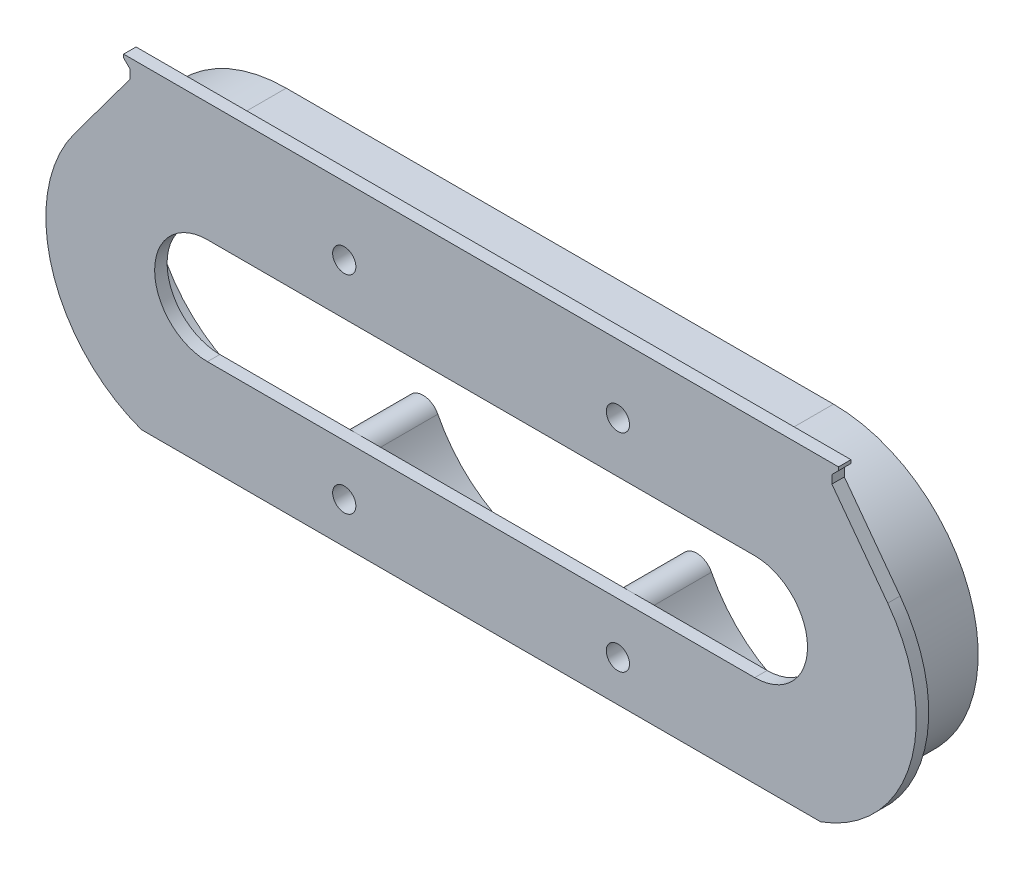
from build123d import *

# Parameters (mm, degrees)
SKETCH1_R               = 1.2
BOSS_EXTRUDE1_DEPTH     = 8
BOSS_EXTRUDE2_DEPTH     = 1.5
CUT_EXTRUDE1_DEPTH      = 125.252015178
CUT_EXTRUDE1_DEPTH_BACK = 125.252015178
SKETCH3_R               = 1.4
CUT_EXTRUDE2_DEPTH      = 125.252015178
SKETCH5_W               = 117.271867341
SKETCH5_H               = 6.016252737
CUT_EXTRUDE3_DEPTH      = 125.252015178


with BuildPart() as part:
    # Sketch1 → Boss-Extrude1 (new body)
    with BuildSketch(Plane.XY):
        with BuildLine():
            Line((32.794822831, -0.95), (98.794822831, -0.95))
            ThreePointArc((98.794822831, -0.95), (116.244822831, 16.5), (98.794822831, 33.95))
            Line((98.794822831, 33.95), (32.794822831, 33.95))
            ThreePointArc((32.794822831, 33.95), (15.344822831, 16.5), (32.794822831, -0.95))
        make_face()
        with Locations((82.294822831, 29)):
            Circle(SKETCH1_R, mode=Mode.SUBTRACT)
        with Locations((49.294822831, 4)):
            Circle(SKETCH1_R, mode=Mode.SUBTRACT)
        with Locations((82.294822831, 4)):
            Circle(SKETCH1_R, mode=Mode.SUBTRACT)
        with Locations((49.294822831, 29)):
            Circle(SKETCH1_R, mode=Mode.SUBTRACT)
        with BuildLine():
            ThreePointArc((84.078606615, 9.037897061), (82.294822831, 10.133399735), (80.511039047, 9.037897061))
            ThreePointArc((80.511039047, 9.037897061), (65.794822831, 0), (51.078606615, 9.037897061))
            ThreePointArc((51.078606615, 9.037897061), (49.294822831, 10.133399735), (47.511039047, 9.037897061))
            ThreePointArc((47.511039047, 9.037897061), (16.294822831, 16.5), (47.511039047, 23.962102939))
            ThreePointArc((47.511039047, 23.962102939), (49.294822831, 22.866600265), (51.078606615, 23.962102939))
            ThreePointArc((51.078606615, 23.962102939), (65.794822831, 33), (80.511039047, 23.962102939))
            ThreePointArc((80.511039047, 23.962102939), (82.294822831, 22.866600265), (84.078606615, 23.962102939))
            ThreePointArc((84.078606615, 23.962102939), (115.294822831, 16.5), (84.078606615, 9.037897061))
        make_face(mode=Mode.SUBTRACT)
    extrude(amount=BOSS_EXTRUDE1_DEPTH)

    # Sketch2 → Boss-Extrude2 (add)
    with BuildSketch(Plane.XY.offset(8)):
        with BuildLine():
            Line((30.807257811, -2), (100.782387851, -2))
            ThreePointArc((100.782387851, -2), (116.415253744, 7.634664408), (114.834700595, 25.929885261))
            Line((114.834700595, 25.929885261), (108.102694429, 35))
            Line((108.102694429, 35), (108.102694429, 36))
            Line((108.102694429, 36), (108.902694429, 36.8))
            Line((108.902694429, 36.8), (108.902694429, 37.2))
            Line((108.902694429, 37.2), (22.686951233, 37.2))
            Line((22.686951233, 37.2), (22.686951233, 36.8))
            Line((22.686951233, 36.8), (23.486951233, 36))
            Line((23.486951233, 36), (23.486951233, 35))
            Line((23.486951233, 35), (16.754945067, 25.929885261))
            ThreePointArc((16.754945067, 25.929885261), (15.174391918, 7.634664408), (30.807257811, -2))
        make_face()
    extrude(amount=BOSS_EXTRUDE2_DEPTH)

    # Sketch3 → Cut-Extrude1 (cut, two sides: drawn at the far end of the back side and taken through both)
    with BuildSketch(Plane(origin=(0, 0, 8), x_dir=(-1, 0, 0), z_dir=(0, 0, -1)).offset(-CUT_EXTRUDE1_DEPTH_BACK)):
        with Locations((-49.294822831, 29)):
            Circle(SKETCH3_R)
        with Locations((-49.294822831, 4)):
            Circle(SKETCH3_R)
        with Locations((-82.294822831, 4)):
            Circle(SKETCH3_R)
        with Locations((-82.294822831, 29)):
            Circle(SKETCH3_R)
    extrude(amount=CUT_EXTRUDE1_DEPTH + CUT_EXTRUDE1_DEPTH_BACK, mode=Mode.SUBTRACT)

    # Sketch4 → Cut-Extrude2 (cut, through all)
    with BuildSketch(Plane(origin=(0, 0, 8), x_dir=(-1, 0, 0), z_dir=(0, 0, -1))):
        with BuildLine():
            Line((-98.794822831, 22.866600265), (-32.794822831, 22.866600265))
            ThreePointArc((-32.794822831, 22.866600265), (-26.428222566, 16.5), (-32.794822831, 10.133399735))
            Line((-32.794822831, 10.133399735), (-98.794822831, 10.133399735))
            ThreePointArc((-98.794822831, 10.133399735), (-105.161423096, 16.5), (-98.794822831, 22.866600265))
        make_face()
    extrude(amount=-CUT_EXTRUDE2_DEPTH, mode=Mode.SUBTRACT)

    # Sketch5 → Cut-Extrude3 (cut, through all)
    with BuildSketch(Plane(origin=(0, 0, 8), x_dir=(-1, 0, 0), z_dir=(0, 0, -1))):
        with Locations((-71.069949673, -3.958126369)):
            Rectangle(SKETCH5_W, SKETCH5_H)
    extrude(amount=-CUT_EXTRUDE3_DEPTH, mode=Mode.SUBTRACT)


solid = part.part
